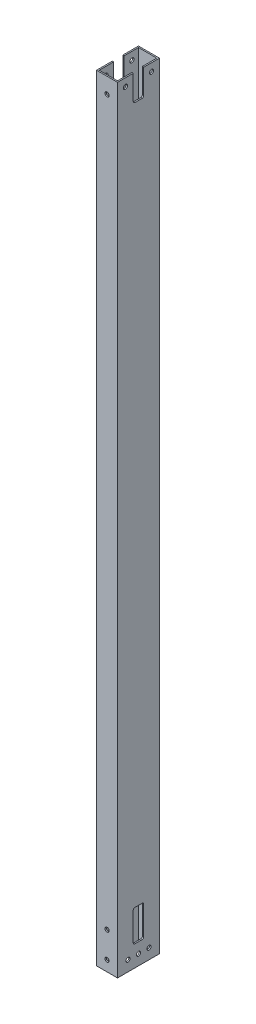
from build123d import *

# Parameters (mm, degrees)
SKETCH1_W              = 25.4
SKETCH1_H              = 50.8
SKETCH1_W_2            = 22.225
SKETCH1_H_2            = 47.625
EXTRUDE_THIN1_DEPTH    = 939.8
CUT_EXTRUDE1_DEPTH     = 941.486235944
F_10_CLEARANCE_HOLE1_D = 5.1054
F_10_CLEARANCE_HOLE2_D = 5.1054


with BuildPart() as part:
    # Sketch1 → Extrude-Thin1 (new body)
    with BuildSketch(Plane(origin=(0, 0, 0), x_dir=(1, 0, 0), z_dir=(0, 1, 0))):
        Rectangle(SKETCH1_W, SKETCH1_H)
        Rectangle(SKETCH1_W_2, SKETCH1_H_2, mode=Mode.SUBTRACT)
    extrude(amount=EXTRUDE_THIN1_DEPTH)

    # Sketch2 → Cut-Extrude1 (cut, through all)
    with BuildSketch(Plane.ZY.offset(12.7)):
        with BuildLine():
            Line((-6.35, 939.8), (6.35, 939.8))
            Line((6.35, 939.8), (6.35, 910.082))
            ThreePointArc((6.35, 910.082), (5.754840979, 908.645159021), (4.318, 908.05))
            Line((4.318, 908.05), (-4.318, 908.05))
            ThreePointArc((-4.318, 908.05), (-5.754840979, 908.645159021), (-6.35, 910.082))
            Line((-6.35, 910.082), (-6.35, 939.8))
        make_face()
        with BuildLine():
            Line((-4.318, 63.5), (4.318, 63.5))
            ThreePointArc((4.318, 63.5), (5.754840979, 62.904840979), (6.35, 61.468))
            Line((6.35, 61.468), (6.35, 27.432))
            ThreePointArc((6.35, 27.432), (5.754840979, 25.995159021), (4.318, 25.4))
            Line((4.318, 25.4), (-4.318, 25.4))
            ThreePointArc((-4.318, 25.4), (-5.754840979, 25.995159021), (-6.35, 27.432))
            Line((-6.35, 27.432), (-6.35, 61.468))
            ThreePointArc((-6.35, 61.468), (-5.754840979, 62.904840979), (-4.318, 63.5))
        make_face()
    extrude(amount=-CUT_EXTRUDE1_DEPTH, mode=Mode.SUBTRACT)

    # #10 Clearance Hole1 (through all)
    with Locations(Plane.XY.offset(25.4)):
        with Locations((0, 920.75), (0, 12.7), (0, 44.45)):
            Hole(F_10_CLEARANCE_HOLE1_D / 2)

    # #10 Clearance Hole2 (through all)
    with Locations(Plane.ZY.offset(12.7)):
        with Locations((15.875, 930.275), (-15.875, 930.275), (-12.7, 12.7), (0, 12.7), (12.7, 12.7)):
            Hole(F_10_CLEARANCE_HOLE2_D / 2)


solid = part.part
